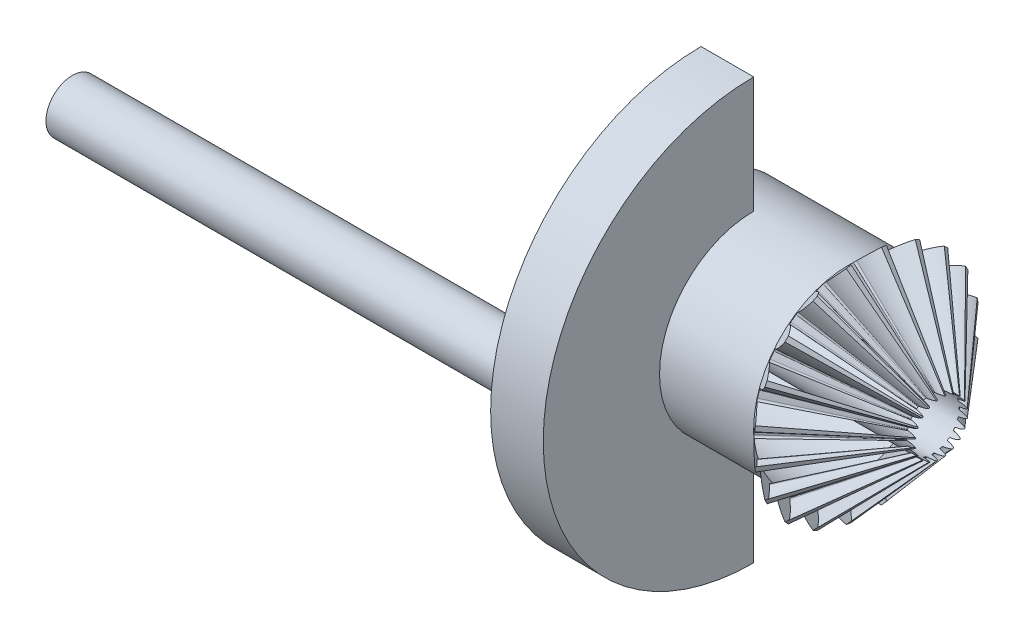
from build123d import *

# Parameters (mm, degrees)
TEETHCUTS_COUNT     = 20
TEETHCUTS_ANGLE     = 342
HUBSKE_R            = 8.949062546
HUB_DEPTH           = 13.949164146
BORSKE_R            = 2.5
BORE_DEPTH          = 25.0000508
BOSS_EXTRUDE1_START = -5
BOSS_EXTRUDE1_DEPTH = 5
BOSS_EXTRUDE2_DEPTH = 50


with BuildPart() as part:
    # BasProSke → Base-Revolve (revolve)
    with BuildSketch(Plane(origin=(0, 0, 0), x_dir=(1, 0, 0), z_dir=(0, 1, 0)), mode=Mode.PRIVATE) as base_revolve_sk:
        Polygon((0, 0), (0, 8.949062547), (1.758044236, 10.707106781), (10.121648124, 1.070710669), (9.945843702, 0.894906248), (9.945843702, 0), align=None)
    revolve(base_revolve_sk.sketch.rotate(Axis((-10, 0, 0), (1, 0, 0)), 180), axis=Axis((-10, 0, 0), (1, 0, 0)))

    # ToothCut: read off the stored shape, not the designer's step
    # ToothCut: loft between two sections, ruled curve by curve
    toothcut_from = [
        Edge.make_bspline([(11.056978059, 0.006040604, -0.009397446), (11.052757644, 0.001820189, -0.014823153), (11.047082221, -0.003855234, -0.014022361), (11.043703013, -0.007234441, -0.007524359)], [0, 0, 0, 0, 1, 1, 1, 1], 3, [1, 0.779680287, 0.779680287, 1]),
        Edge.make_bspline([(11.043703013, -0.007234441, 0.007524359), (11.047082221, -0.003855234, 0.014022361), (11.052757644, 0.001820189, 0.014823153), (11.056978059, 0.006040604, 0.009397446)], [0, 0, 0, 0, 1, 1, 1, 1], 3, [1, 0.779680287, 0.779680287, 1]),
        Edge.make_bspline([(11.043703013, -0.007234441, -0.007524359), (11.043200956, -0.007736499, -0.006558934), (11.042799872, -0.008137583, -0.005503268), (11.04250773, -0.008429724, -0.004378334)], [0, 0, 0, 0, 1, 1, 1, 1], 3, [1, 0.993377071, 0.993377071, 1]),
        Edge.make_bspline([(11.04250773, -0.008429724, 0.004378334), (11.042799872, -0.008137583, 0.005503268), (11.043200956, -0.007736499, 0.006558934), (11.043703013, -0.007234441, 0.007524359)], [0, 0, 0, 0, 1, 1, 1, 1], 3, [1, 0.993377071, 0.993377071, 1]),
        Edge.make_bspline([(11.04250773, -0.008429724, -0.004378334), (11.041765856, -0.009171599, -0.001521635), (11.041765856, -0.009171599, 0.001521635), (11.04250773, -0.008429724, 0.004378334)], [0, 0, 0, 0, 1, 1, 1, 1], 3, [1, 0.959129516, 0.959129516, 1]),
        Edge.make_line((11.056978059, 0.006040604, 0.009397446), (11.056978059, 0.006040604, -0.009397446)),
    ]
    toothcut_to = [
        Edge.make_bspline([(1.831702175, 10.780764719, -1.608058394), (1.416177176, 10.365239721, -1.022568098), (0.895186141, 9.844248687, -0.641441323), (0.317192874, 9.266255421, -0.500131372)], [0, 0, 0, 0, 1, 1, 1, 1], 3, [1, 0.968992554, 0.968992554, 1]),
        Edge.make_bspline([(0.317192874, 9.266255421, 0.500131372), (0.895186141, 9.844248687, 0.641441323), (1.416177176, 10.365239721, 1.022568098), (1.831702175, 10.780764719, 1.608058394)], [0, 0, 0, 0, 1, 1, 1, 1], 3, [1, 0.968992554, 0.968992554, 1]),
        Edge.make_bspline([(0.317192874, 9.266255421, -0.500131372), (0.248143517, 9.197206064, -0.483249928), (0.20395306, 9.153015607, -0.406340777), (0.206397022, 9.155459569, -0.307302074)], [0, 0, 0, 0, 1, 1, 1, 1], 3, [1, 0.835744927, 0.835744927, 1]),
        Edge.make_bspline([(0.206397022, 9.155459569, 0.307302074), (0.20395306, 9.153015607, 0.406340777), (0.248143517, 9.197206064, 0.483249928), (0.317192874, 9.266255421, 0.500131372)], [0, 0, 0, 0, 1, 1, 1, 1], 3, [1, 0.835744927, 0.835744927, 1]),
        Edge.make_bspline([(0.206397022, 9.155459569, -0.307302074), (0.211451493, 9.16051404, -0.102475588), (0.211451493, 9.16051404, 0.102475588), (0.206397022, 9.155459569, 0.307302074)], [0, 0, 0, 0, 1, 1, 1, 1], 3, [1, 0.999594406, 0.999594406, 1]),
        Edge.make_line((1.831702175, 10.780764719, 1.608058394), (1.831702175, 10.780764719, -1.608058394)),
    ]
    toothcut = Solid(Shell([*[Face.make_surface_from_curves(toothcut_from[k], toothcut_to[k]) for k in range(6)], Face(Wire(toothcut_from)), Face(Wire(toothcut_to))]))
    add(toothcut, mode=Mode.SUBTRACT)

    # TeethCuts: ToothCut ×20 about axis
    teethcuts_axis = Axis((-10, 0, 0), (1, 0, 0))
    for i in range(1, TEETHCUTS_COUNT):
        add(toothcut.rotate(teethcuts_axis, i * TEETHCUTS_ANGLE / (TEETHCUTS_COUNT - 1)), mode=Mode.SUBTRACT)

    # HubSke → Hub (add)
    with BuildSketch(Plane.ZY):
        Circle(HUBSKE_R)
    extrude(amount=HUB_DEPTH)

    # BorSke → Bore (cut, symmetric)
    with BuildSketch(Plane(origin=(0, 0, 0), x_dir=(0, 0, -1), z_dir=(1, 0, 0))):
        with Locations(Location((0, 0, 0), (0, 0, 180))):
            Circle(BORSKE_R)
    extrude(amount=BORE_DEPTH, both=True, mode=Mode.SUBTRACT)

    # Sketch1 → Boss-Extrude1 (add)
    with BuildSketch(Plane.ZY.offset(13.949164146).offset(BOSS_EXTRUDE1_START)):
        with BuildLine():
            Line((0, 20), (0, 2.5))
            ThreePointArc((0, 2.5), (2.5, 0), (0, -2.5))
            Line((0, -2.5), (0, -20))
            ThreePointArc((0, -20), (20, 0), (0, 20))
        make_face()
    extrude(amount=BOSS_EXTRUDE1_DEPTH)

    # Sketch2 → Boss-Extrude2 (add)
    with BuildSketch(Plane(origin=(-8.949164146, 0, 0), x_dir=(0, 0, -1), z_dir=(1, 0, 0))):
        with BuildLine():
            ThreePointArc((-17.261196716, 0), (-14.761196716, -2.5), (-12.261196716, 0))
            Line((-12.261196716, 0), (-17.261196716, 0))
        make_face()
        with BuildLine():
            Line((-17.261196716, 0), (-12.261196716, 0))
            ThreePointArc((-12.261196716, 0), (-14.761196716, 2.5), (-17.261196716, 0))
        make_face()
    extrude(amount=-BOSS_EXTRUDE2_DEPTH)


solid = part.part
